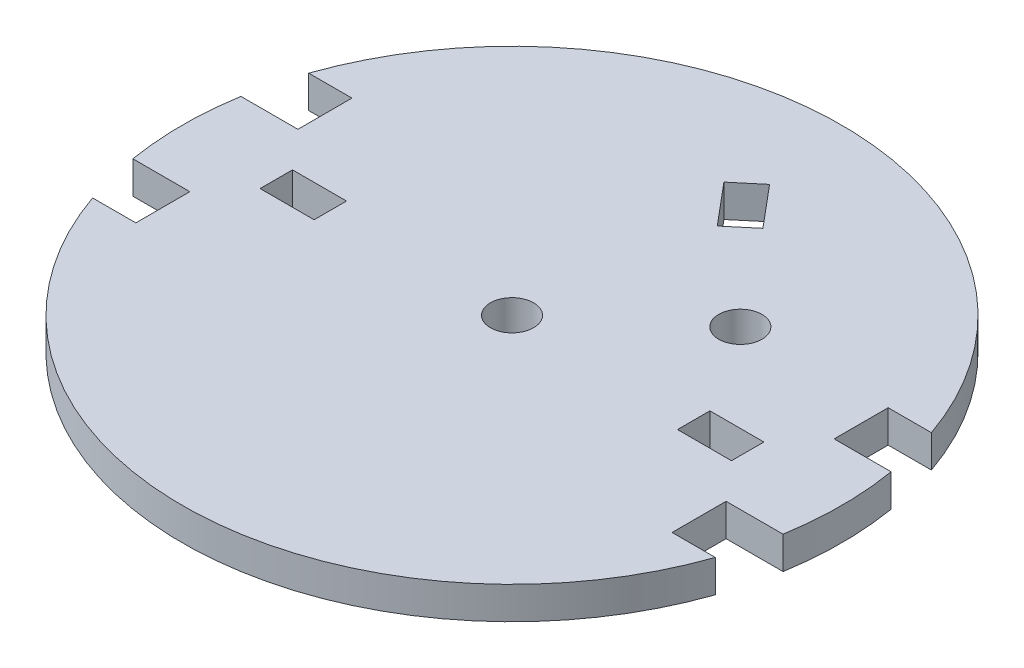
from build123d import *

# Parameters (mm, degrees)
CROQUIS1_R              = 30.5
SALIENTE_EXTRUIR1_DEPTH = 3
CROQUIS2_R              = 2
CORTAR_EXTRUIR1_DEPTH   = 4
CORTAR_EXTRUIR3_START   = -4
CORTAR_EXTRUIR3_DEPTH   = 4
CROQUIS6_W              = 5
CROQUIS6_H              = 3
CORTAR_EXTRUIR4_DEPTH   = 4
CROQUIS7_R              = 2
CORTAR_EXTRUIR5_DEPTH   = 4


with BuildPart() as part:
    # Croquis1 → Saliente-Extruir1 (new body)
    with BuildSketch(Plane(origin=(0, 0, 0), x_dir=(1, 0, 0), z_dir=(0, 1, 0))):
        Circle(CROQUIS1_R)
    extrude(amount=SALIENTE_EXTRUIR1_DEPTH)

    # Croquis2 → Cortar-Extruir1 (cut)
    with BuildSketch(Plane(origin=(0, 3, 0), x_dir=(1, 0, 0), z_dir=(0, 1, 0))):
        Circle(CROQUIS2_R)
    extrude(amount=-CORTAR_EXTRUIR1_DEPTH, mode=Mode.SUBTRACT)

    # Croquis5 → Cortar-Extruir3 (cut)
    with BuildSketch(Plane(origin=(0, 3, 0), x_dir=(1, 0, 0), z_dir=(0, 1, 0)).offset(CORTAR_EXTRUIR3_START)):
        with BuildLine():
            Line((30.087372767, -5), (24.814059068, -5))
            Line((24.814059068, -5), (24.814059068, -10))
            Line((24.814059068, -10), (28.814059068, -10))
            ThreePointArc((28.814059068, -10), (29.556634924, -7.526973624), (30.087372767, -5))
        make_face()
        with BuildLine():
            Line((24.814059068, 5), (30.087372767, 5))
            ThreePointArc((30.087372767, 5), (29.556634924, 7.526973624), (28.814059068, 10))
            Line((28.814059068, 10), (24.814059068, 10))
            Line((24.814059068, 10), (24.814059068, 5))
        make_face()
        with BuildLine():
            ThreePointArc((-30.087372767, -5), (-29.556634924, -7.526973624), (-28.814059068, -10))
            Line((-28.814059068, -10), (-24.814059068, -10))
            Line((-24.814059068, -10), (-24.814059068, -5))
            Line((-24.814059068, -5), (-30.087372767, -5))
        make_face()
        with BuildLine():
            Line((-24.814059068, 10), (-28.814059068, 10))
            ThreePointArc((-28.814059068, 10), (-29.556634924, 7.526973624), (-30.087372767, 5))
            Line((-30.087372767, 5), (-24.814059068, 5))
            Line((-24.814059068, 5), (-24.814059068, 10))
        make_face()
    extrude(amount=CORTAR_EXTRUIR3_DEPTH, mode=Mode.SUBTRACT)

    # Croquis6 → Cortar-Extruir4 (cut)
    with BuildSketch(Plane(origin=(0, 3, 0), x_dir=(1, 0, 0), z_dir=(0, 1, 0))):
        with Locations((-19.314059068, 0)):
            Rectangle(CROQUIS6_W, CROQUIS6_H)
        with Locations((19.314059068, 0)):
            Rectangle(CROQUIS6_W, CROQUIS6_H)
    extrude(amount=-CORTAR_EXTRUIR4_DEPTH, mode=Mode.SUBTRACT)

    # Croquis7 → Cortar-Extruir5 (cut)
    with BuildSketch(Plane(origin=(0, 3, 0), x_dir=(1, 0, 0), z_dir=(0, 1, 0))):
        Polygon((1.428390211, 22.411430151), (-0.869743118, 20.483067322), (2.34419493, 16.652845106), (4.642328259, 18.581207935), align=None)
        with Locations((11.490666647, 9.641814145)):
            Circle(CROQUIS7_R)
    extrude(amount=-CORTAR_EXTRUIR5_DEPTH, mode=Mode.SUBTRACT)


solid = part.part
